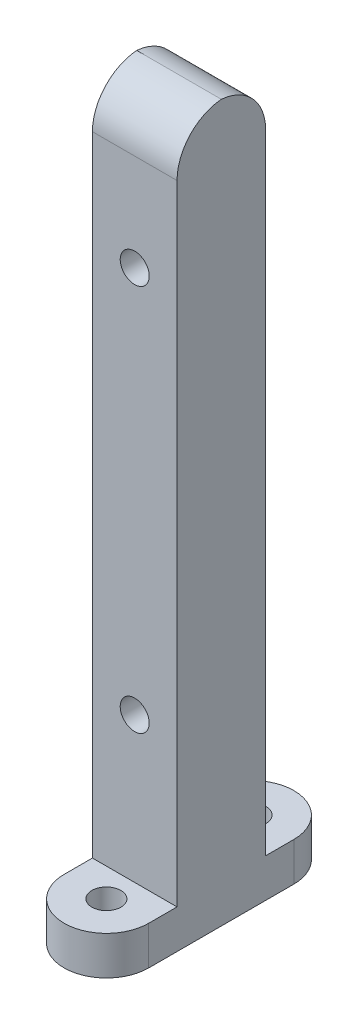
from build123d import *

# Parameters (mm, degrees)
SKETCH1_R           = 1.5
BOSS_EXTRUDE1_DEPTH = 4
SKETCH2_W           = 8.74452312
SKETCH2_H           = 9.151316648
BOSS_EXTRUDE2_DEPTH = 70
FILLET3_R           = 5
SKETCH6_R           = 1.5
CUT_EXTRUDE2_DEPTH  = 55


with BuildPart() as part:
    # Sketch1 → Boss-Extrude1 (new body)
    with BuildSketch(Plane(origin=(0, 0, 0), x_dir=(1, 0, 0), z_dir=(0, 1, 0))):
        with BuildLine():
            Line((4.37226156, 0), (4.37226156, -15))
            ThreePointArc((4.37226156, -15), (0, -19.37226156), (-4.37226156, -15))
            Line((-4.37226156, -15), (-4.37226156, 0))
            ThreePointArc((-4.37226156, 0), (0, 4.37226156), (4.37226156, 0))
        make_face()
        with Locations(Location((0, 0, 0), (0, 0, 270))):
            Circle(SKETCH1_R, mode=Mode.SUBTRACT)
        with Locations(Location((0, -15, 0), (0, 0, 270))):
            Circle(SKETCH1_R, mode=Mode.SUBTRACT)
    extrude(amount=BOSS_EXTRUDE1_DEPTH)

    # Sketch2 → Boss-Extrude2 (add)
    with BuildSketch(Plane(origin=(0, 4, 0), x_dir=(1, 0, 0), z_dir=(0, 1, 0))):
        with Locations((0, -7.5)):
            Rectangle(SKETCH2_W, SKETCH2_H)
    extrude(amount=BOSS_EXTRUDE2_DEPTH)

    # Fillet3
    # the kernel refuses this fillet: 5 mm, written as the material it takes off along each edge
    with BuildSketch(Plane(origin=(-16.87226156, 74, 2.924341676), x_dir=(0, -1, 0), z_dir=(1, 0, 0)), Plane(origin=(16.87226156, 74, 12.075658324), x_dir=(0, -1, 0), z_dir=(-1, 0, 0))) as fillet3_piece_1:
        with BuildLine():
            CenterArc((FILLET3_R, -FILLET3_R), FILLET3_R, 90, 90)
            Line((0, -FILLET3_R), (0, 0))
            Line((0, 0), (FILLET3_R, 0))
        make_face()
    extrude(amount=33.74452312, mode=Mode.SUBTRACT)

    # Sketch6 → Cut-Extrude2 (cut)
    with BuildSketch(Plane.XY.offset(12.075658324)):
        with Locations((0, 59)):
            Circle(SKETCH6_R)
        with Locations(Location((0, 19, 0), (0, 0, 180))):
            Circle(SKETCH6_R)
    extrude(amount=-CUT_EXTRUDE2_DEPTH, mode=Mode.SUBTRACT)


solid = part.part
